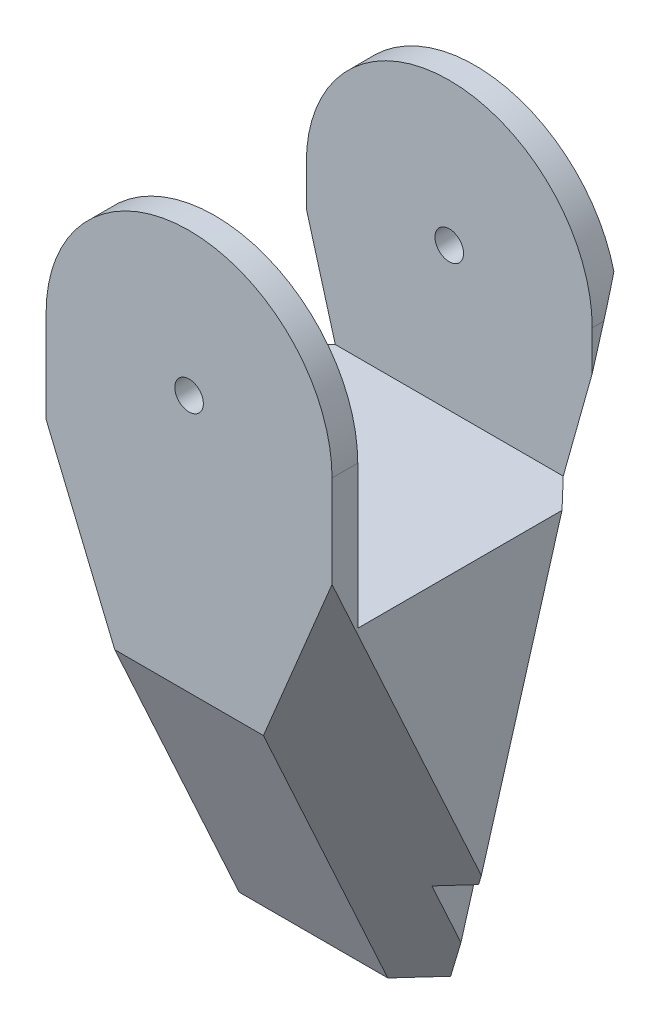
from build123d import *

# Parameters (mm, degrees)
SKETCH1_W               = 50
SKETCH1_H               = 50
BOSS_EXTRUDE1_DEPTH     = 100
SKETCH4_R               = 2.5
BOSS_EXTRUDE2_DEPTH     = 4.5
CUT_EXTRUDE1_DEPTH      = 161.078105936
CUT_EXTRUDE1_DEPTH_BACK = 161.078105936
SKETCH5_R               = 2.5
SKETCH6_W               = 50
SKETCH6_H               = 50
CUT_EXTRUDE2_DEPTH      = 4.5
CUT_EXTRUDE5_DEPTH      = 161.078105936
CUT_EXTRUDE5_DEPTH_BACK = 161.078105936
CHAMFER1_SIZE           = 12


with BuildPart() as part:
    # Sketch1 → Boss-Extrude1 (new body)
    with BuildSketch(Plane(origin=(0, 0, 0), x_dir=(1, 0, 0), z_dir=(0, 1, 0))):
        Rectangle(SKETCH1_W, SKETCH1_H)
    extrude(amount=BOSS_EXTRUDE1_DEPTH)

    # Sketch4 → Boss-Extrude2 (add)
    with BuildSketch(Plane(origin=(0, 0, -25), x_dir=(-1, 0, 0), z_dir=(0, 0, -1))):
        with BuildLine():
            Line((-25, 100), (25, 100))
            Line((25, 100), (25, 125))
            ThreePointArc((25, 125), (0, 150), (-25, 125))
            Line((-25, 125), (-25, 100))
        make_face()
        with Locations((0, 125)):
            Circle(SKETCH4_R, mode=Mode.SUBTRACT)
    boss_extrude2 = extrude(amount=-BOSS_EXTRUDE2_DEPTH)

    # Mirror2: Boss-Extrude2 across plane
    add(boss_extrude2.mirror(Plane.XY))

    # Sketch5 → Cut-Extrude1 (cut, two sides: drawn at the far end of the back side and taken through both)
    with BuildSketch(Plane.ZY.offset(-25).offset(-CUT_EXTRUDE1_DEPTH_BACK)):
        with BuildLine():
            Line((-25, 0), (2.6e-08, 0))
            ThreePointArc((2.6e-08, 0), (-17.67766952, 7.322330461), (-25, 25))
            Line((-25, 25), (-25, 0))
        make_face()
        with BuildLine():
            Line((25, 0), (25, 25))
            ThreePointArc((25, 25), (17.677669539, 7.32233048), (2.6e-08, 0))
            Line((2.6e-08, 0), (25, 0))
        make_face()
        with Locations((0, 25)):
            Circle(SKETCH5_R)
    extrude(amount=CUT_EXTRUDE1_DEPTH + CUT_EXTRUDE1_DEPTH_BACK, mode=Mode.SUBTRACT)

    # Sketch6 → Cut-Extrude2 (cut)
    with BuildSketch(Plane(origin=(25, 0, 0), x_dir=(0, 0, -1), z_dir=(1, 0, 0))):
        with Locations((0, 25)):
            Rectangle(SKETCH6_W, SKETCH6_H)
    cut_extrude2 = extrude(amount=-CUT_EXTRUDE2_DEPTH, mode=Mode.SUBTRACT)

    # Mirror3: Cut-Extrude2 across plane
    add(cut_extrude2.mirror(Plane(origin=(0, 0, 0), x_dir=(0, 0, 1), z_dir=(1, 0, 0))), mode=Mode.SUBTRACT)

    # Sketch8 → Cut-Extrude5 (cut, two sides: drawn at the far end of the back side and taken through both)
    with BuildSketch(Plane(origin=(25, 0, 0), x_dir=(0, 0, -1), z_dir=(1, 0, 0)).offset(-CUT_EXTRUDE5_DEPTH_BACK)):
        Polygon((-25, 80), (-3.250930707, 32.404472018), (11.086507283, 32.404472018), (25, 80), (47.596959839, 33.904901575), (18.755369464, -23.278135991), (-42.095384797, 0), align=None)
    extrude(amount=CUT_EXTRUDE5_DEPTH + CUT_EXTRUDE5_DEPTH_BACK, mode=Mode.SUBTRACT)

    # Chamfer1
    chamfer1_edges = [part.edges().sort_by_distance(p)[0] for p in [
        (25, 65, 18.145657728),
        (-25, 65, 18.145657728),
    ]]
    chamfer(chamfer1_edges, length=CHAMFER1_SIZE)

    # Chamfer2
    # the kernel refuses this chamfer: 15 mm, written as the material it takes off along each edge
    with BuildSketch(Plane(origin=(25, -38.861557394, 9.746529416), x_dir=(0.02749587661058632, 0.2804786274156753, 0.9594663706104734), z_dir=(0, 0.9598292658239239, -0.2805847117501368)), Plane(origin=(-25, 168.861557394, -50.976697476), x_dir=(-0.027495876610586306, 0.2804786274156753, 0.9594663706104732), z_dir=(0, -0.9598292658239239, 0.2805847117501368))) as chamfer2_piece_1:
        with BuildLine():
            Line((15.430097928, 0), (-0.848207323, -15.406766903))
            Line((-0.848207323, -15.406766903), (-1.148093898, -15.39851814))
            ThreePointArc((-1.148093898, -15.39851814), (-0.511938406, -7.700967445), (-0.299886575, 0.008248763))
            Line((-0.299886575, 0.008248763), (0.008248763, 0.299886575))
            ThreePointArc((0.008248763, 0.299886575), (7.717464971, 0.087834744), (15.438346691, 0.299886575))
            Line((15.438346691, 0.299886575), (15.430097928, 0))
        make_face()
    extrude(amount=216.416733875, mode=Mode.SUBTRACT)


solid = part.part
